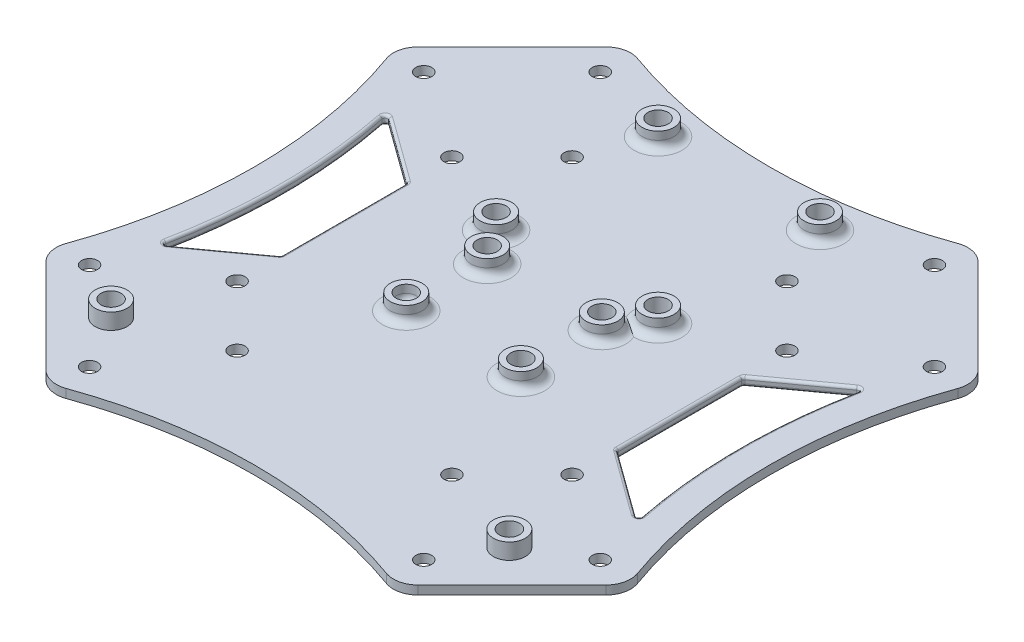
from build123d import *

# Parameters (mm, degrees)
BOSS_EXTRUDE1_DEPTH      = 0.825
BOSS_EXTRUDE1_DEPTH_BACK = 0.825
SKETCH3_R                = 1.5
CUT_EXTRUDE2_DEPTH       = 1.65
SKETCH16_R               = 3
SKETCH16_R_2             = 1.9
BOSS_EXTRUDE7_DEPTH      = 3
FILLET5_R                = 1.5
CUT_EXTRUDE6_DEPTH       = 77.532419601
FILLET6_R                = 0.5


with BuildPart() as part:
    # Sketch1 → Boss-Extrude1 (new, two sides: drawn at the far end of the back side and taken through both)
    with BuildSketch(Plane(origin=(0, 0, 0), x_dir=(1, 0, 0), z_dir=(0, 1, 0)).offset(-BOSS_EXTRUDE1_DEPTH_BACK)):
        with BuildLine():
            Line((35.046361717, 52.705589829), (52.705589829, 35.046361717))
            ThreePointArc((52.705589829, 35.046361717), (53.961944938, 32.762265708), (53.8, 30.160478519))
            ThreePointArc((53.8, 30.160478519), (48.55, 0), (53.8, -30.160478519))
            ThreePointArc((53.8, -30.160478519), (53.961944938, -32.762265708), (52.705589829, -35.046361717))
            Line((52.705589829, -35.046361717), (35.046361717, -52.705589829))
            ThreePointArc((35.046361717, -52.705589829), (32.762265708, -53.961944938), (30.160478519, -53.8))
            ThreePointArc((30.160478519, -53.8), (0, -48.55), (-30.160478519, -53.8))
            ThreePointArc((-30.160478519, -53.8), (-32.762265708, -53.961944938), (-35.046361717, -52.705589829))
            Line((-35.046361717, -52.705589829), (-52.705589829, -35.046361717))
            ThreePointArc((-52.705589829, -35.046361717), (-53.961944938, -32.762265708), (-53.8, -30.160478519))
            ThreePointArc((-53.8, -30.160478519), (-48.55, 0), (-53.8, 30.160478519))
            ThreePointArc((-53.8, 30.160478519), (-53.961944938, 32.762265708), (-52.705589829, 35.046361717))
            Line((-52.705589829, 35.046361717), (-35.046361717, 52.705589829))
            ThreePointArc((-35.046361717, 52.705589829), (-32.762265708, 53.961944938), (-30.160478519, 53.8))
            ThreePointArc((-30.160478519, 53.8), (0, 48.55), (30.160478519, 53.8))
            ThreePointArc((30.160478519, 53.8), (32.762265708, 53.961944938), (35.046361717, 52.705589829))
        make_face()
    extrude(amount=BOSS_EXTRUDE1_DEPTH + BOSS_EXTRUDE1_DEPTH_BACK)

    # Sketch3 → Cut-Extrude2 (cut)
    with BuildSketch(Plane(origin=(0, 0.825, 0), x_dir=(1, 0, 0), z_dir=(0, 1, 0))):
        with Locations(Location((-48.083261121, -31.466251763, 0), (0, 0, 270))):
            Circle(SKETCH3_R)
        with Locations(Location((-31.466251763, -48.083261121, 0), (0, 0, 270))):
            Circle(SKETCH3_R)
        with Locations(Location((31.466251763, -48.083261121, 0), (0, 0, 270))):
            Circle(SKETCH3_R)
        with Locations(Location((48.083261121, -31.466251763, 0), (0, 0, 270))):
            Circle(SKETCH3_R)
        with Locations(Location((48.083261121, 31.466251763, 0), (0, 0, 270))):
            Circle(SKETCH3_R)
        with Locations(Location((31.466251763, 48.083261121, 0), (0, 0, 270))):
            Circle(SKETCH3_R)
        with Locations(Location((-31.466251763, 48.083261121, 0), (0, 0, 270))):
            Circle(SKETCH3_R)
        with Locations(Location((-48.083261121, 31.466251763, 0), (0, 0, 270))):
            Circle(SKETCH3_R)
        with Locations(Location((-31.540291459, -20.22658296, 0), (0, 0, 270))):
            Circle(SKETCH3_R)
        with Locations(Location((-20.22658296, -31.540291459, 0), (0, 0, 270))):
            Circle(SKETCH3_R)
        with Locations(Location((-31.540291459, 20.22658296, 0), (0, 0, 270))):
            Circle(SKETCH3_R)
        with Locations(Location((-20.22658296, 31.540291459, 0), (0, 0, 270))):
            Circle(SKETCH3_R)
        with Locations(Location((20.22658296, 31.540291459, 0), (0, 0, 270))):
            Circle(SKETCH3_R)
        with Locations(Location((31.540291459, 20.22658296, 0), (0, 0, 270))):
            Circle(SKETCH3_R)
        with Locations(Location((31.540291459, -20.22658296, 0), (0, 0, 270))):
            Circle(SKETCH3_R)
        with Locations(Location((20.22658296, -31.540291459, 0), (0, 0, 270))):
            Circle(SKETCH3_R)
    extrude(amount=-CUT_EXTRUDE2_DEPTH, mode=Mode.SUBTRACT)

    # Sketch16 → Boss-Extrude7 (add)
    # profile 1 of 10: a face of its own
    with BuildSketch(Plane(origin=(0, 0.825, 0), x_dir=(1, 0, 0), z_dir=(0, 1, 0))):
        with Locations(Location((-15.5, 43, 0), (0, 0, 270))):
            Circle(SKETCH16_R)
        with Locations(Location((-15.5, 43, 0), (0, 0, 270))):
            Circle(SKETCH16_R_2, mode=Mode.SUBTRACT)
    # profile 2 of 10: a face of its own
    with BuildSketch(Plane(origin=(0, 0.825, 0), x_dir=(1, 0, 0), z_dir=(0, 1, 0))):
        with Locations(Location((15, 43, 0), (0, 0, 270))):
            Circle(SKETCH16_R)
        with Locations(Location((15, 43, 0), (0, 0, 270))):
            Circle(SKETCH16_R_2, mode=Mode.SUBTRACT)
    # profile 3 of 10: a face of its own
    with BuildSketch(Plane(origin=(0, 0.825, 0), x_dir=(1, 0, 0), z_dir=(0, 1, 0))):
        with Locations(Location((15, 12.5, 0), (0, 0, 270))):
            Circle(SKETCH16_R)
        with Locations(Location((15, 12.5, 0), (0, 0, 270))):
            Circle(SKETCH16_R_2, mode=Mode.SUBTRACT)
    # profile 4 of 10: a face of its own
    with BuildSketch(Plane(origin=(0, 0.825, 0), x_dir=(1, 0, 0), z_dir=(0, 1, 0))):
        with Locations(Location((-15.5, 12.5, 0), (0, 0, 270))):
            Circle(SKETCH16_R)
        with Locations(Location((-15.5, 12.5, 0), (0, 0, 270))):
            Circle(SKETCH16_R_2, mode=Mode.SUBTRACT)
    # profile 5 of 10: a face of its own
    with BuildSketch(Plane(origin=(0, 0.825, 0), x_dir=(1, 0, 0), z_dir=(0, 1, 0))):
        with Locations(Location((10.795, 6.12, 0), (0, 0, 270))):
            Circle(SKETCH16_R)
        with Locations(Location((10.795, 6.12, 0), (0, 0, 270))):
            Circle(SKETCH16_R_2, mode=Mode.SUBTRACT)
    # profile 6 of 10: a face of its own
    with BuildSketch(Plane(origin=(0, 0.825, 0), x_dir=(1, 0, 0), z_dir=(0, 1, 0))):
        with Locations(Location((-10.795, 6.12, 0), (0, 0, 270))):
            Circle(SKETCH16_R)
        with Locations(Location((-10.795, 6.12, 0), (0, 0, 270))):
            Circle(SKETCH16_R_2, mode=Mode.SUBTRACT)
    # profile 7 of 10: a face of its own
    with BuildSketch(Plane(origin=(0, 0.825, 0), x_dir=(1, 0, 0), z_dir=(0, 1, 0))):
        with Locations(Location((10.795, -9.12, 0), (0, 0, 270))):
            Circle(SKETCH16_R)
        with Locations(Location((10.795, -9.12, 0), (0, 0, 270))):
            Circle(SKETCH16_R_2, mode=Mode.SUBTRACT)
    # profile 8 of 10: a face of its own
    with BuildSketch(Plane(origin=(0, 0.825, 0), x_dir=(1, 0, 0), z_dir=(0, 1, 0))):
        with Locations(Location((-10.795, -9.12, 0), (0, 0, 270))):
            Circle(SKETCH16_R)
        with Locations(Location((-10.795, -9.12, 0), (0, 0, 270))):
            Circle(SKETCH16_R_2, mode=Mode.SUBTRACT)
    # profile 9 of 10: a face of its own
    with BuildSketch(Plane(origin=(0, 0.825, 0), x_dir=(1, 0, 0), z_dir=(0, 1, 0))):
        with Locations(Location((-37.5, -38, 0), (0, 0, 270))):
            Circle(SKETCH16_R)
        with Locations(Location((-37.5, -38, 0), (0, 0, 270))):
            Circle(SKETCH16_R_2, mode=Mode.SUBTRACT)
    # profile 10 of 10: a face of its own
    with BuildSketch(Plane(origin=(0, 0.825, 0), x_dir=(1, 0, 0), z_dir=(0, 1, 0))):
        with Locations(Location((37.5, -38, 0), (0, 0, 270))):
            Circle(SKETCH16_R)
        with Locations(Location((37.5, -38, 0), (0, 0, 270))):
            Circle(SKETCH16_R_2, mode=Mode.SUBTRACT)
    extrude(amount=BOSS_EXTRUDE7_DEPTH)

    # Fillet5
    # the kernel refuses this fillet: 1.5 mm, written as the material it adds along each edge
    with BuildSketch(Plane(origin=(-15.5, 0.825, -43), x_dir=(0, 0, 1), z_dir=(-1, 0, 0))) as fillet5_piece_1:
        with BuildLine():
            CenterArc((3 + FILLET5_R, FILLET5_R), FILLET5_R, 180, 90)
            Line((3, FILLET5_R), (3, 0))
            Line((3, 0), (3 + FILLET5_R, 0))
        make_face()
    revolve(axis=Axis((-15.5, 0.825, -43), (0, 1, 0)))
    with BuildSketch(Plane(origin=(15, 0.825, -43), x_dir=(0, 0, 1), z_dir=(-1, 0, 0))) as fillet5_piece_2:
        with BuildLine():
            CenterArc((3 + FILLET5_R, FILLET5_R), FILLET5_R, 180, 90)
            Line((3, FILLET5_R), (3, 0))
            Line((3, 0), (3 + FILLET5_R, 0))
        make_face()
    revolve(axis=Axis((15, 0.825, -43), (0, 1, 0)))
    with BuildSketch(Plane(origin=(15, 0.825, -12.5), x_dir=(0, 0, 1), z_dir=(-1, 0, 0))) as fillet5_piece_3:
        with BuildLine():
            CenterArc((3 + FILLET5_R, FILLET5_R), FILLET5_R, 180, 90)
            Line((3, FILLET5_R), (3, 0))
            Line((3, 0), (3 + FILLET5_R, 0))
        make_face()
    revolve(axis=Axis((15, 0.825, -12.5), (0, 1, 0)))
    with BuildSketch(Plane(origin=(-15.5, 0.825, -12.5), x_dir=(0, 0, 1), z_dir=(-1, 0, 0))) as fillet5_piece_4:
        with BuildLine():
            CenterArc((3 + FILLET5_R, FILLET5_R), FILLET5_R, 180, 90)
            Line((3, FILLET5_R), (3, 0))
            Line((3, 0), (3 + FILLET5_R, 0))
        make_face()
    revolve(axis=Axis((-15.5, 0.825, -12.5), (0, 1, 0)))
    with BuildSketch(Plane(origin=(10.795, 0.825, -6.12), x_dir=(0, 0, 1), z_dir=(-1, 0, 0))) as fillet5_piece_5:
        with BuildLine():
            CenterArc((3 + FILLET5_R, FILLET5_R), FILLET5_R, 180, 90)
            Line((3, FILLET5_R), (3, 0))
            Line((3, 0), (3 + FILLET5_R, 0))
        make_face()
    revolve(axis=Axis((10.795, 0.825, -6.12), (0, 1, 0)))
    with BuildSketch(Plane(origin=(-10.795, 0.825, -6.12), x_dir=(0, 0, 1), z_dir=(-1, 0, 0))) as fillet5_piece_6:
        with BuildLine():
            CenterArc((3 + FILLET5_R, FILLET5_R), FILLET5_R, 180, 90)
            Line((3, FILLET5_R), (3, 0))
            Line((3, 0), (3 + FILLET5_R, 0))
        make_face()
    revolve(axis=Axis((-10.795, 0.825, -6.12), (0, 1, 0)))
    with BuildSketch(Plane(origin=(10.795, 0.825, 9.12), x_dir=(0, 0, 1), z_dir=(-1, 0, 0))) as fillet5_piece_7:
        with BuildLine():
            CenterArc((3 + FILLET5_R, FILLET5_R), FILLET5_R, 180, 90)
            Line((3, FILLET5_R), (3, 0))
            Line((3, 0), (3 + FILLET5_R, 0))
        make_face()
    revolve(axis=Axis((10.795, 0.825, 9.12), (0, 1, 0)))
    with BuildSketch(Plane(origin=(-10.795, 0.825, 9.12), x_dir=(0, 0, 1), z_dir=(-1, 0, 0))) as fillet5_piece_8:
        with BuildLine():
            CenterArc((1.9 - FILLET5_R, FILLET5_R), FILLET5_R, 270, 90)
            Line((1.9 - FILLET5_R, 0), (1.9, 0))
            Line((1.9, 0), (1.9, FILLET5_R))
        make_face()
    revolve(axis=Axis((-10.795, 0.825, 9.12), (0, 1, 0)))
    with BuildSketch(Plane(origin=(-10.795, 0.825, 9.12), x_dir=(0, 0, 1), z_dir=(-1, 0, 0))) as fillet5_piece_9:
        with BuildLine():
            CenterArc((3 + FILLET5_R, FILLET5_R), FILLET5_R, 180, 90)
            Line((3, FILLET5_R), (3, 0))
            Line((3, 0), (3 + FILLET5_R, 0))
        make_face()
    revolve(axis=Axis((-10.795, 0.825, 9.12), (0, 1, 0)))

    # Sketch18 → Cut-Extrude6 (cut, through all)
    with BuildSketch(Plane(origin=(0, 0.825, 0), x_dir=(1, 0, 0), z_dir=(0, 1, 0))):
        with BuildLine():
            Line((31.644069454, 11.859246829), (31.644069454, -11.859246829))
            Line((31.644069454, -11.859246829), (45.096327721, -21.605978387))
            ThreePointArc((45.096327721, -21.605978387), (42.827389147, 0), (45.096327721, 21.605978387))
            Line((45.096327721, 21.605978387), (31.644069454, 11.859246829))
        make_face()
        with BuildLine():
            Line((-31.644069454, 11.859246829), (-45.096327721, 21.605978387))
            ThreePointArc((-45.096327721, 21.605978387), (-42.827389147, 0), (-45.096327721, -21.605978387))
            Line((-45.096327721, -21.605978387), (-31.644069454, -11.859246829))
            Line((-31.644069454, -11.859246829), (-31.644069454, 11.859246829))
        make_face()
    extrude(amount=-CUT_EXTRUDE6_DEPTH, mode=Mode.SUBTRACT)

    # Fillet6
    fillet6_edges = [part.edges().sort_by_distance(p)[0] for p in [
        (38.370198587, -0.825, -16.732612608),
        (31.644069454, 0, -11.859246829),
        (42.827389147, -0.825, 0),
        (45.096327721, 0, -21.605978387),
        (38.370198587, -0.825, 16.732612608),
        (45.096327721, 0, 21.605978387),
        (31.644069454, -0.825, 0),
        (31.644069454, 0, 11.859246829),
        (38.370198587, 0.825, -16.732612608),
        (31.644069454, 0.825, 0),
        (38.370198587, 0.825, 16.732612608),
        (42.827389147, 0.825, 0),
        (-42.827389147, -0.825, 0),
        (-45.096327721, 0, 21.605978387),
        (-38.370198587, -0.825, -16.732612608),
        (-45.096327721, 0, -21.605978387),
        (-31.644069454, -0.825, 0),
        (-31.644069454, 0, -11.859246829),
        (-38.370198587, -0.825, 16.732612608),
        (-31.644069454, 0, 11.859246829),
        (-42.827389147, 0.825, 0),
        (-38.370198587, 0.825, 16.732612608),
        (-31.644069454, 0.825, 0),
        (-38.370198587, 0.825, -16.732612608),
    ]]
    fillet(fillet6_edges, radius=FILLET6_R)


solid = part.part
